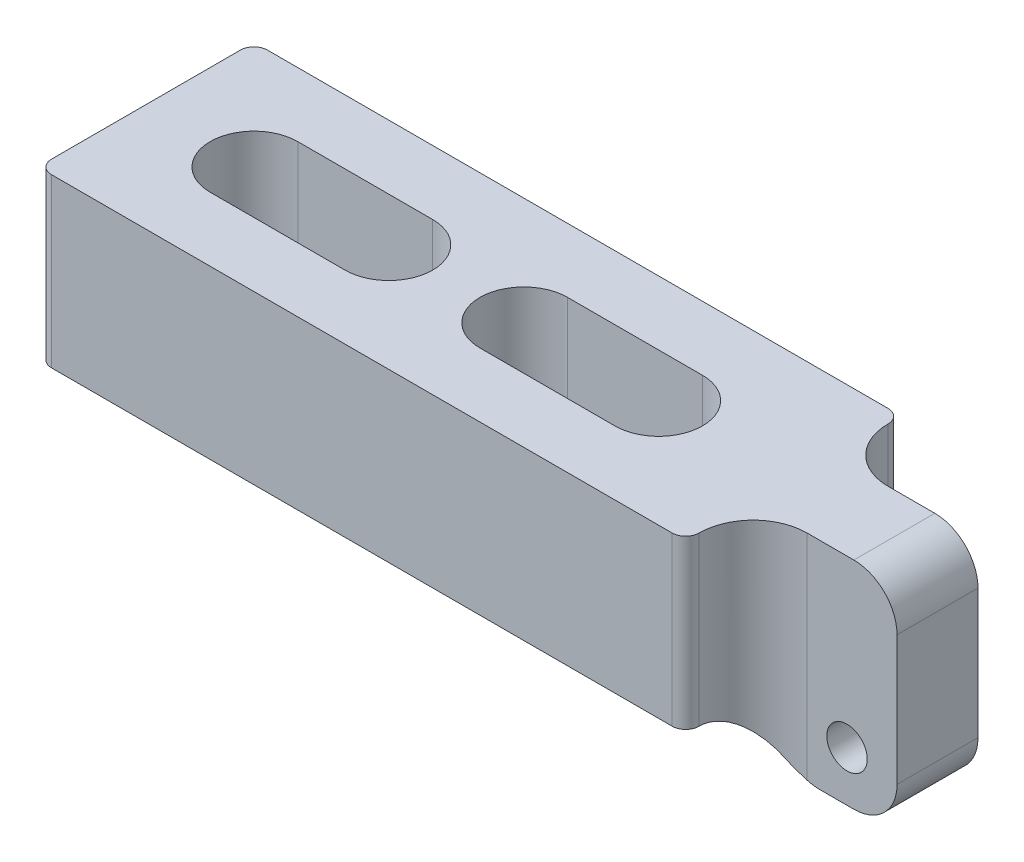
from build123d import *

# Parameters (mm, degrees)
SKETCH1_R           = 1.190625
BOSS_EXTRUDE1_DEPTH = 12.7
SKETCH5_W           = 8.46735418
SKETCH5_H           = 3.96875
CUT_EXTRUDE2_DEPTH  = 48.176397098
FILLET1_R           = 2.54
FILLET2_START       = -2.835892255
FILLET2_DEPTH       = 12.592298151
FILLET2_2_DEPTH     = 13
CUT_EXTRUDE3_DEPTH  = 48.176397125
FILLET3_R           = 0.79375


with BuildPart() as part:
    # Sketch1 → Boss-Extrude1 (new body)
    with BuildSketch(Plane.XY):
        Polygon((2.943594104, -2.943594104), (2.943594104, 9.756405896), (-43.623760076, 9.756405896), (-43.623760076, -0.0889), (-5.523760076, -0.0889), (-2.669065971, -2.943594104), align=None)
        Circle(SKETCH1_R, mode=Mode.SUBTRACT)
    extrude(amount=BOSS_EXTRUDE1_DEPTH)

    # Sketch5 → Cut-Extrude2 (cut, through all)
    with BuildSketch(Plane.XZ.offset(2.943594104)):
        with Locations((-1.290082986, 10.715625)):
            Rectangle(SKETCH5_W, SKETCH5_H)
        with Locations((-1.290082986, 1.984375)):
            Rectangle(SKETCH5_W, SKETCH5_H)
    extrude(amount=-CUT_EXTRUDE2_DEPTH, mode=Mode.SUBTRACT)

    # Fillet1
    fillet1_edges = [part.edges().sort_by_distance(p)[0] for p in [
        (-2.669065971, -2.943594104, 6.35),
        (2.943594104, 9.756405896, 6.35),
        (2.943594104, -2.943594104, 6.35),
    ]]
    fillet(fillet1_edges, radius=FILLET1_R)

    # Fillet2: read off the stored shape, not the designer's step
    # Fillet2 outline → Fillet2 (add)
    with BuildSketch(Plane(origin=(0, 0, 0), x_dir=(1, 0, 0), z_dir=(0, 1, 0)).offset(FILLET2_START)):
        with BuildLine():
            ThreePointArc((-5.523760076, -11.90625), (-4.593824106, -9.66118597), (-2.348760076, -8.73125))
            Line((-2.348760076, -8.73125), (-5.523760076, -8.73125))
            Line((-5.523760076, -8.73125), (-5.523760076, -11.90625))
        make_face()
        with BuildLine():
            ThreePointArc((-2.348760076, -3.96875), (-4.593824106, -3.03881403), (-5.523760076, -0.79375))
            Line((-5.523760076, -0.79375), (-5.523760076, -3.96875))
            Line((-5.523760076, -3.96875), (-2.348760076, -3.96875))
        make_face()
    extrude(amount=FILLET2_DEPTH)

    # Fillet2 2 outline → Fillet2 2 (cut)
    with BuildSketch(Plane.XY):
        with BuildLine():
            ThreePointArc((-2.348760048, -2.835892163), (-2.92030771, -2.583707388), (-3.413014747, -2.199645328))
            Line((-3.413014747, -2.199645328), (-5.523760076, -0.0889))
            Line((-5.523760076, -0.0889), (-5.523760076, -2.835892255))
            Line((-5.523760076, -2.835892255), (-2.348760048, -2.835892163))
        make_face()
    extrude(amount=FILLET2_2_DEPTH, mode=Mode.SUBTRACT)

    # Sketch9 → Cut-Extrude3 (cut, through all)
    with BuildSketch(Plane(origin=(0, 9.756405896, 0), x_dir=(1, 0, 0), z_dir=(0, 1, 0))):
        with BuildLine():
            Line((-37.273760076, -3.7719), (-29.336260076, -3.7719))
            ThreePointArc((-29.336260076, -3.7719), (-26.758160076, -6.35), (-29.336260076, -8.9281))
            Line((-29.336260076, -8.9281), (-37.273760076, -8.9281))
            ThreePointArc((-37.273760076, -8.9281), (-39.851860076, -6.35), (-37.273760076, -3.7719))
        make_face()
        with BuildLine():
            Line((-21.398760076, -3.7719), (-13.461260076, -3.7719))
            ThreePointArc((-13.461260076, -3.7719), (-10.883160076, -6.35), (-13.461260076, -8.9281))
            Line((-13.461260076, -8.9281), (-21.398760076, -8.9281))
            ThreePointArc((-21.398760076, -8.9281), (-23.976860076, -6.35), (-21.398760076, -3.7719))
        make_face()
    extrude(amount=-CUT_EXTRUDE3_DEPTH, mode=Mode.SUBTRACT)

    # Fillet3
    fillet3_edges = [part.edges().sort_by_distance(p)[0] for p in [
        (-43.623760076, 4.833752948, 12.7),
        (-43.623760076, 4.833752948, 0),
        (-5.523760076, 4.833752948, 12.7),
        (-5.523760076, 4.833752948, 0),
    ]]
    fillet(fillet3_edges, radius=FILLET3_R - 0.0001)  # a hair under: the kernel refuses the full size


solid = part.part
